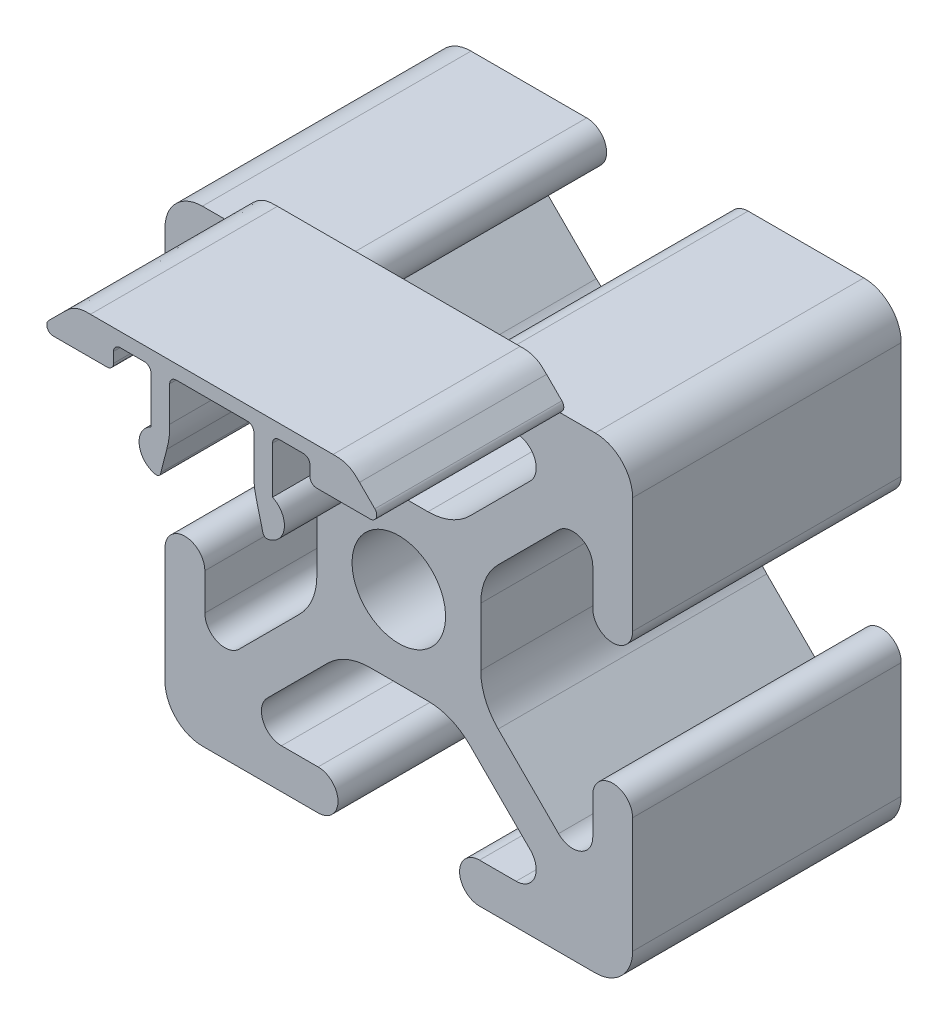
from build123d import *

# Parameters (mm, degrees)
SKETCH11_R                             = 2.5
F_25_SERIES_EXTRUSIONS_25_2525_1_DEPTH = 14.359821885
BOSS_EXTRUDE1_DEPTH                    = 10
FILLET1_R                              = 0.35
FILLET4_DEPTH                          = 10


with BuildPart() as part:
    # Sketch11 → 25 series extrusions 25-2525(1) (new body)
    with BuildSketch(Plane(origin=(0, 0, 0), x_dir=(-1, 0, 0), z_dir=(0, 0, -1))):
        with BuildLine():
            Line((12.5, -10.5), (12.5, -4.315))
            ThreePointArc((12.5, -4.315), (11.435, -3.25), (10.37, -4.315))
            Line((10.37, -4.315), (10.37, -6.272801987))
            ThreePointArc((10.37, -6.272801987), (9.708114403, -7.263383786), (8.539643501, -7.030960473))
            Line((8.539643501, -7.030960473), (5.311043881, -3.802360852))
            ThreePointArc((5.311043881, -3.802360852), (4.622790395, -2.77231672), (4.381107911, -1.557296822))
            Line((4.381107911, -1.557296822), (4.381107911, 1.557296822))
            ThreePointArc((4.381107911, 1.557296822), (4.622790395, 2.77231672), (5.311043881, 3.802360852))
            Line((5.311043881, 3.802360852), (8.539643501, 7.030960473))
            ThreePointArc((8.539643501, 7.030960473), (9.708114403, 7.263383786), (10.37, 6.272801987))
            Line((10.37, 6.272801987), (10.37, 4.315))
            ThreePointArc((10.37, 4.315), (11.435, 3.25), (12.5, 4.315))
            Line((12.5, 4.315), (12.5, 10.5))
            ThreePointArc((12.5, 10.5), (11.914213562, 11.914213562), (10.5, 12.5))
            Line((10.5, 12.5), (4.315, 12.5))
            ThreePointArc((4.315, 12.5), (3.25, 11.435), (4.315, 10.37))
            Line((4.315, 10.37), (6.272801987, 10.37))
            ThreePointArc((6.272801987, 10.37), (7.263383786, 9.708114403), (7.030960473, 8.539643501))
            Line((7.030960473, 8.539643501), (3.802360852, 5.311043881))
            ThreePointArc((3.802360852, 5.311043881), (2.77231672, 4.622790395), (1.557296822, 4.381107911))
            Line((1.557296822, 4.381107911), (-1.557296822, 4.381107911))
            ThreePointArc((-1.557296822, 4.381107911), (-2.77231672, 4.622790395), (-3.802360852, 5.311043881))
            Line((-3.802360852, 5.311043881), (-7.030960473, 8.539643501))
            ThreePointArc((-7.030960473, 8.539643501), (-7.263383786, 9.708114403), (-6.272801987, 10.37))
            Line((-6.272801987, 10.37), (-4.315, 10.37))
            ThreePointArc((-4.315, 10.37), (-3.25, 11.435), (-4.315, 12.5))
            Line((-4.315, 12.5), (-10.5, 12.5))
            ThreePointArc((-10.5, 12.5), (-11.914213562, 11.914213562), (-12.5, 10.5))
            Line((-12.5, 10.5), (-12.5, 4.315))
            ThreePointArc((-12.5, 4.315), (-11.435, 3.25), (-10.37, 4.315))
            Line((-10.37, 4.315), (-10.37, 6.272801987))
            ThreePointArc((-10.37, 6.272801987), (-9.708114403, 7.263383786), (-8.539643501, 7.030960473))
            Line((-8.539643501, 7.030960473), (-5.311043881, 3.802360852))
            ThreePointArc((-5.311043881, 3.802360852), (-4.622790395, 2.77231672), (-4.381107911, 1.557296822))
            Line((-4.381107911, 1.557296822), (-4.381107911, -1.557296822))
            ThreePointArc((-4.381107911, -1.557296822), (-4.622790395, -2.77231672), (-5.311043881, -3.802360852))
            Line((-5.311043881, -3.802360852), (-8.539643501, -7.030960473))
            ThreePointArc((-8.539643501, -7.030960473), (-9.708114403, -7.263383786), (-10.37, -6.272801987))
            Line((-10.37, -6.272801987), (-10.37, -4.315))
            ThreePointArc((-10.37, -4.315), (-11.435, -3.25), (-12.5, -4.315))
            Line((-12.5, -4.315), (-12.5, -10.5))
            ThreePointArc((-12.5, -10.5), (-11.914213562, -11.914213562), (-10.5, -12.5))
            Line((-10.5, -12.5), (-4.315, -12.5))
            ThreePointArc((-4.315, -12.5), (-3.25, -11.435), (-4.315, -10.37))
            Line((-4.315, -10.37), (-6.272801987, -10.37))
            ThreePointArc((-6.272801987, -10.37), (-7.263383786, -9.708114403), (-7.030960473, -8.539643501))
            Line((-7.030960473, -8.539643501), (-3.802360852, -5.311043881))
            ThreePointArc((-3.802360852, -5.311043881), (-2.77231672, -4.622790395), (-1.557296822, -4.381107911))
            Line((-1.557296822, -4.381107911), (1.557296822, -4.381107911))
            ThreePointArc((1.557296822, -4.381107911), (2.77231672, -4.622790395), (3.802360852, -5.311043881))
            Line((3.802360852, -5.311043881), (7.030960473, -8.539643501))
            ThreePointArc((7.030960473, -8.539643501), (7.263383786, -9.708114403), (6.272801987, -10.37))
            Line((6.272801987, -10.37), (4.315, -10.37))
            ThreePointArc((4.315, -10.37), (3.25, -11.435), (4.315, -12.5))
            Line((4.315, -12.5), (10.5, -12.5))
            ThreePointArc((10.5, -12.5), (11.914213562, -11.914213562), (12.5, -10.5))
        make_face()
        Circle(SKETCH11_R, mode=Mode.SUBTRACT)
    extrude(amount=F_25_SERIES_EXTRUSIONS_25_2525_1_DEPTH)


with BuildPart() as body_2:
    # Sketch14 → Boss-Extrude1 (new body)
    with BuildSketch(Plane.XY):
        with BuildLine():
            Line((-9.315, 12.5), (-7.315, 14.5))
            Line((-7.315, 14.5), (7.315, 14.5))
            Line((7.315, 14.5), (9.315, 12.5))
            Line((9.315, 12.5), (5.25, 12.5))
            Line((5.25, 12.5), (5.25, 13.75))
            Line((5.25, 13.75), (3.25, 13.75))
            Line((3.25, 13.75), (3.25, 10.9))
            ThreePointArc((3.25, 10.9), (3.859144243, 9.66498424), (2.785208105, 8.803020314))
            Line((2.785208105, 8.803020314), (2.25, 10.9))
            Line((2.25, 10.9), (2.25, 13.75))
            Line((2.25, 13.75), (-2.25, 13.75))
            Line((-2.25, 13.75), (-2.25, 10.9))
            Line((-2.25, 10.9), (-2.785208105, 8.803020314))
            ThreePointArc((-2.785208105, 8.803020314), (-3.859144243, 9.66498424), (-3.25, 10.9))
            Line((-3.25, 10.9), (-3.25, 13.75))
            Line((-3.25, 13.75), (-5.25, 13.75))
            Line((-5.25, 13.75), (-5.25, 12.5))
            Line((-5.25, 12.5), (-9.315, 12.5))
        make_face()
    extrude(amount=BOSS_EXTRUDE1_DEPTH)

    # Fillet1
    fillet1_edges = [body_2.edges().sort_by_distance(p)[0] for p in [
        (-9.315, 12.5, 5),
        (9.315, 12.5, 5),
        (5.25, 12.5, 5),
        (5.25, 13.75, 5),
        (3.25, 13.75, 5),
        (2.25, 13.75, 5),
        (-2.25, 13.75, 5),
        (-3.25, 13.75, 5),
        (-5.25, 13.75, 5),
        (-5.25, 12.5, 5),
    ]]
    fillet(fillet1_edges, radius=FILLET1_R)

    # Fillet2
    # a fillet whose section is not a circle: 2 mm, written as the material it takes off along each edge
    with BuildSketch(Plane(origin=(-7.315, 14.5, -2.071067812), x_dir=(-0.7071067811865508, -0.7071067811865444, 0), z_dir=(0, 0, 1)), Plane(origin=(7.315, 14.5, -2.071067812), x_dir=(-1, 0, 0), z_dir=(0, 0, 1))) as fillet2_piece_1:
        with BuildLine():
            add(Edge.make_bspline([(0.828427125, 0), (0.676784525, 0), (0.525141925, 0), (0.186837399, 0.028463796), (-0.111987048, 0.152240935), (-0.371331417, 0.371331417), (-0.478558927, 0.478558927), (-0.585786438, 0.585786438)], knots=[0, 0, 0, 0, 0, 0, 0.5, 0.5, 1, 1, 1, 1, 1, 1], degree=5))
            Line((-0.585786438, 0.585786438), (0, 0))
            Line((0, 0), (0.828427125, 0))
        make_face()
    extrude(amount=14.142135624, mode=Mode.SUBTRACT)

    # Fillet3
    # a fillet whose section is not a circle: 5 mm, written as the material it takes off along each edge
    with BuildSketch(Plane(origin=(2.25, 10.9, -1.570010707), x_dir=(0, 1, 0), z_dir=(0, 0, 1)), Plane(origin=(-2.25, 10.9, -1.570010707), x_dir=(-0.24730040696589287, -0.9689388570567824, 0), z_dir=(0, 0, 1))) as fillet3_piece_1:
        with BuildLine():
            add(Edge.make_bspline([(0.628004283, 0), (0.510529941, 0), (0.3930556, 0), (0.131844663, -0.006577423), (-0.126122818, -0.03897836), (-0.380846844, -0.09720281), (-0.494672298, -0.126254262), (-0.608497752, -0.155305715)], knots=[0, 0, 0, 0, 0, 0, 0.5, 0.5, 1, 1, 1, 1, 1, 1], degree=5))
            Line((-0.608497752, -0.155305715), (0, 0))
            Line((0, 0), (0.628004283, 0))
        make_face()
    extrude(amount=13.140021414, mode=Mode.SUBTRACT)

    # Fillet4: read off the stored shape, not the designer's step
    # Fillet4 outline → Fillet4 (cut)
    with BuildSketch(Plane.XY):
        with BuildLine():
            ThreePointArc((2.785208105, 8.803020314), (2.941353117, 8.814159104), (3.094335826, 8.847349886))
            add(Edge.make_bspline(
                [(3.094335826, 8.847349886), (3.040436849, 8.831566866), (2.986247473, 8.819433643), (2.879523937, 8.809590473), (2.797123937, 8.853068941), (2.74504319, 8.960389027), (2.7321949, 9.010729454), (2.719346609, 9.061069881)],
                knots=[0, 0, 0, 0, 0, 0, 0.5, 0.5, 1, 1, 1, 1, 1, 1], degree=5))
            Line((2.719346609, 9.061069881), (2.785208105, 8.803020314))
        make_face()
        with BuildLine():
            Line((-2.785208105, 8.803020314), (-2.719346609, 9.061069881))
            add(Edge.make_bspline(
                [(-2.719346609, 9.061069881), (-2.7321949, 9.010729454), (-2.74504319, 8.960389027), (-2.797123937, 8.853068941), (-2.879523937, 8.809590473), (-2.986247473, 8.819433643), (-3.040436849, 8.831566866), (-3.094335826, 8.847349886)],
                knots=[0, 0, 0, 0, 0, 0, 0.5, 0.5, 1, 1, 1, 1, 1, 1], degree=5))
            ThreePointArc((-3.094335826, 8.847349886), (-2.941353117, 8.814159104), (-2.785208105, 8.803020314))
        make_face()
    extrude(amount=FILLET4_DEPTH, mode=Mode.SUBTRACT)


solid = Compound([part.part, body_2.part])
